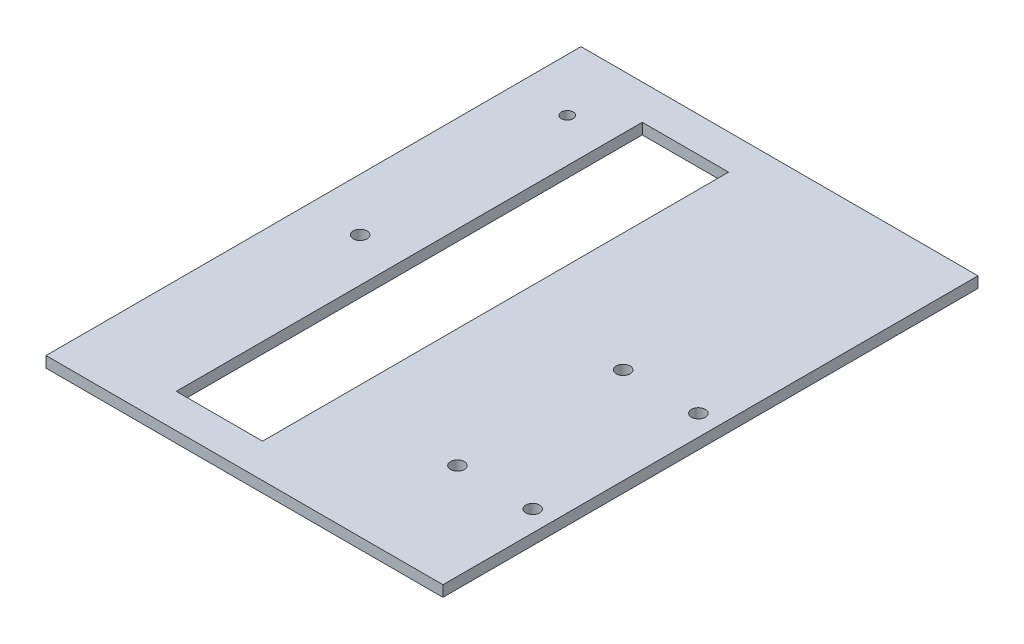
from build123d import *

# Parameters (mm, degrees)
SKETCH1_R           = 2
SKETCH1_R_2         = 1.7
SKETCH1_W           = 25
SKETCH1_H           = 135
BOSS_EXTRUDE1_DEPTH = 3.175


with BuildPart() as part:
    # Sketch1 → Boss-Extrude1 (new body)
    with BuildSketch(Plane(origin=(0, 0, 0), x_dir=(1, 0, 0), z_dir=(0, 1, 0))):
        Polygon((67.674333466, 92.651811553), (67.674333466, -62.348188447), (-47.325666534, -62.348188447), (-47.325666534, -27.044565342), (-47.325666534, 92.651811553), align=None)
        with Locations((61.674333466, 17.651811553)):
            Circle(SKETCH1_R, mode=Mode.SUBTRACT)
        with Locations((61.674333466, -30.348188447)):
            Circle(SKETCH1_R, mode=Mode.SUBTRACT)
        with Locations((-32.086624165, 13.427366475)):
            Circle(SKETCH1_R, mode=Mode.SUBTRACT)
        with Locations((-32.086624165, 73.427366475)):
            Circle(SKETCH1_R_2, mode=Mode.SUBTRACT)
        with Locations((39.87799371, 17.651811553)):
            Circle(SKETCH1_R, mode=Mode.SUBTRACT)
        with Locations((39.87799371, -30.348188447)):
            Circle(SKETCH1_R, mode=Mode.SUBTRACT)
        with Locations((-6.974333466, 15.039519235)):
            Rectangle(SKETCH1_W, SKETCH1_H, mode=Mode.SUBTRACT)
    extrude(amount=BOSS_EXTRUDE1_DEPTH)


solid = part.part
